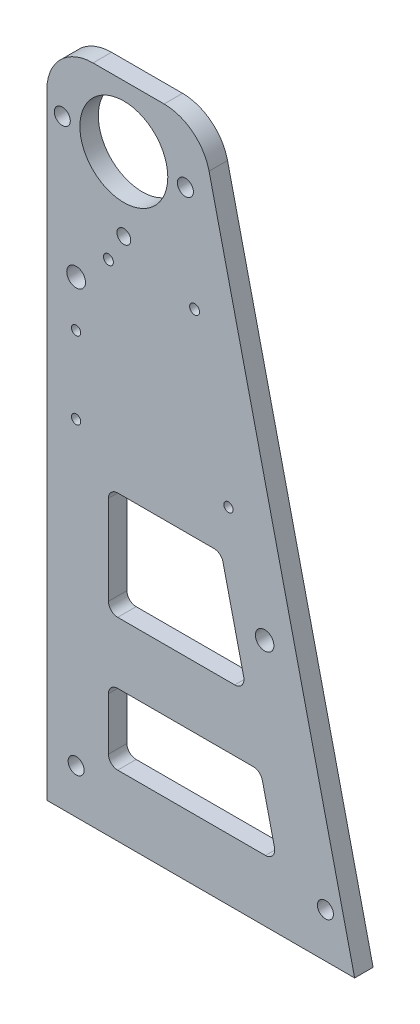
from build123d import *

# Parameters (mm, degrees)
ESBO_O1_R                = 14.2875
ESBO_O1_R_2              = 2.6
RESSALTO_EXTRUS_O2_DEPTH = 6
FILETE1_R                = 15
ESBO_O3_R                = 1.5
ESBO_O3_R_2              = 2.6
ESBO_O3_R_3              = 3.05
CORTE_EXTRUS_O1_DEPTH    = 238.194013415
ESBO_O5_R                = 2.25
ESBO_O5_R_2              = 3
ESBO_O5_R_3              = 1.6
ESBO_O5_R_4              = 2.6
CORTE_EXTRUS_O2_DEPTH    = 238.194013415


with BuildPart() as part:
    # Esboço1 → Ressalto-extrusão2 (new body)
    with BuildSketch(Plane.XY):
        Polygon((0, 0), (0, 215), (50, 215), (100, 0), align=None)
        with Locations((25, 195)):
            Circle(ESBO_O1_R, mode=Mode.SUBTRACT)
        with Locations((9.5, 14.5)):
            Circle(ESBO_O1_R_2, mode=Mode.SUBTRACT)
        with BuildLine():
            Line((20, 95), (20, 66))
            ThreePointArc((20, 66), (20.878679656, 63.878679656), (23, 63))
            Line((23, 63), (61.03739436, 63))
            ThreePointArc((61.03739436, 63), (63.386715693, 64.134339454), (63.959418441, 66.679540484))
            Line((63.959418441, 66.679540484), (57.215232395, 95.679540484))
            ThreePointArc((57.215232395, 95.679540484), (56.15886886, 97.349321333), (54.293208314, 98))
            Line((54.293208314, 98), (23, 98))
            ThreePointArc((23, 98), (20.878679656, 97.121320344), (20, 95))
        make_face(mode=Mode.SUBTRACT)
        with BuildLine():
            Line((20, 40), (20, 23))
            ThreePointArc((20, 23), (20.878679656, 20.878679656), (23, 20))
            Line((23, 20), (71.03739436, 20))
            ThreePointArc((71.03739436, 20), (73.386715693, 21.134339454), (73.959418441, 23.679540484))
            Line((73.959418441, 23.679540484), (70.005930069, 40.679540484))
            ThreePointArc((70.005930069, 40.679540484), (68.949566534, 42.349321333), (67.083905988, 43))
            Line((67.083905988, 43), (23, 43))
            ThreePointArc((23, 43), (20.878679656, 42.121320344), (20, 40))
        make_face(mode=Mode.SUBTRACT)
    extrude(amount=RESSALTO_EXTRUS_O2_DEPTH)

    # Filete1
    filete1_edges = [part.edges().sort_by_distance(p)[0] for p in [
        (0, 215, 3),
        (50, 215, 3),
    ]]
    fillet(filete1_edges, radius=FILETE1_R)

    # Esboço3 → Corte-extrusão1 (cut, through all)
    with BuildSketch(Plane(origin=(0, 0, 0), x_dir=(-1, 0, 0), z_dir=(0, 0, -1))):
        with Locations((-9.5, 112)):
            Circle(ESBO_O3_R)
        with Locations((-90.5, 14.5)):
            Circle(ESBO_O3_R_2)
        with Locations((-9.5, 137)):
            Circle(ESBO_O3_R)
        with Locations((-9.5, 152)):
            Circle(ESBO_O3_R_3)
        with Locations((-59, 112)):
            Circle(ESBO_O3_R)
    extrude(amount=-CORTE_EXTRUS_O1_DEPTH, mode=Mode.SUBTRACT)

    # Esboço5 → Corte-extrusão2 (cut, through all)
    with BuildSketch(Plane(origin=(0, 0, 0), x_dir=(-1, 0, 0), z_dir=(0, 0, -1))):
        with Locations((-25, 171.1875)):
            Circle(ESBO_O5_R)
        with Locations((-70.759810426, 80.398555206)):
            Circle(ESBO_O5_R_2)
        with Locations((-20, 162.1875)):
            Circle(ESBO_O5_R_3)
        with Locations((-48, 162.1875)):
            Circle(ESBO_O5_R_3)
        with Locations((-45, 195)):
            Circle(ESBO_O5_R_4)
        with Locations((-5, 195)):
            Circle(ESBO_O5_R_4)
    extrude(amount=-CORTE_EXTRUS_O2_DEPTH, mode=Mode.SUBTRACT)


solid = part.part
